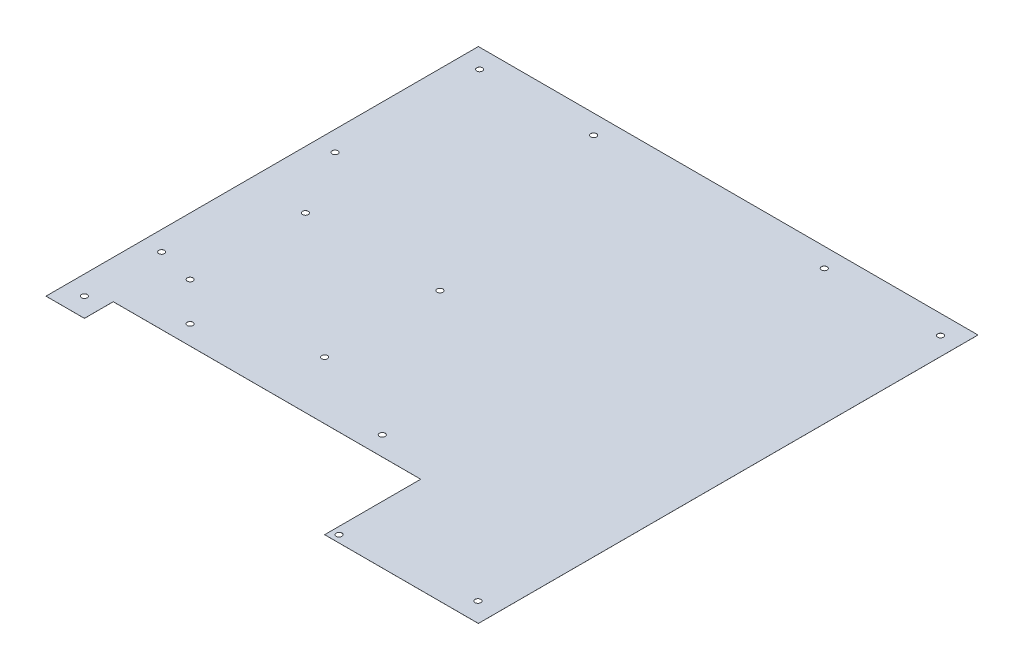
from build123d import *

# Parameters (mm, degrees)
BOSS_EXTRUDE1_DEPTH              = 0.0254
F_6_CLEARANCE_HOLE1_D            = 3.7973
F_6_CLEARANCE_HOLE3_MOUNT_SIDE_D = 3.7973
F_6_CLEARANCE_HOLE2_D            = 3.7973


with BuildPart() as part:
    # Sketch1 → Boss-Extrude1 (new body)
    with BuildSketch(Plane(origin=(0, 0, 0), x_dir=(1, 0, 0), z_dir=(0, 1, 0))):
        Polygon((-165.1, -120.65), (-165.1, 165.1), (165.1, 165.1), (165.1, -165.1), (63.5, -165.1), (63.5, -101.6), (-139.7, -101.6), (-139.7, -120.65), align=None)
    extrude(amount=BOSS_EXTRUDE1_DEPTH)

    # #6 Clearance Hole1 (through all)
    with Locations(Plane(origin=(-76.2, 0.0254, -152.4), x_dir=(0, 0, 1), z_dir=(0, 1, 0))):
        with Locations((0, 0), (0, 152.4), (0, -75.3745), (0, 229.2477), (304.8, 228.3079), (312.7375, 144.4625), (260.35, -76.2), (241.3, -25.4), (241.3, 101.6)):
            Hole(F_6_CLEARANCE_HOLE1_D / 2)

    # #6 Clearance Hole3 - Mount Side (through all)
    with Locations(Plane(origin=(-151.8539, 0.0254, -57.149523043), x_dir=(0, 0, 1), z_dir=(0, 1, 0))):
        with Locations((0, 0), (114.299523043, -0.3302)):
            Hole(F_6_CLEARANCE_HOLE3_MOUNT_SIDE_D / 2)

    # #6 Clearance Hole2 (through all)
    with Locations(Plane(origin=(-127, 0.0254, -12.7), x_dir=(0, 0, 1), z_dir=(0, 1, 0))):
        with Locations((0, 0), (0, 88.9), (76.2, 88.9), (76.2, 0)):
            Hole(F_6_CLEARANCE_HOLE2_D / 2)


solid = part.part
